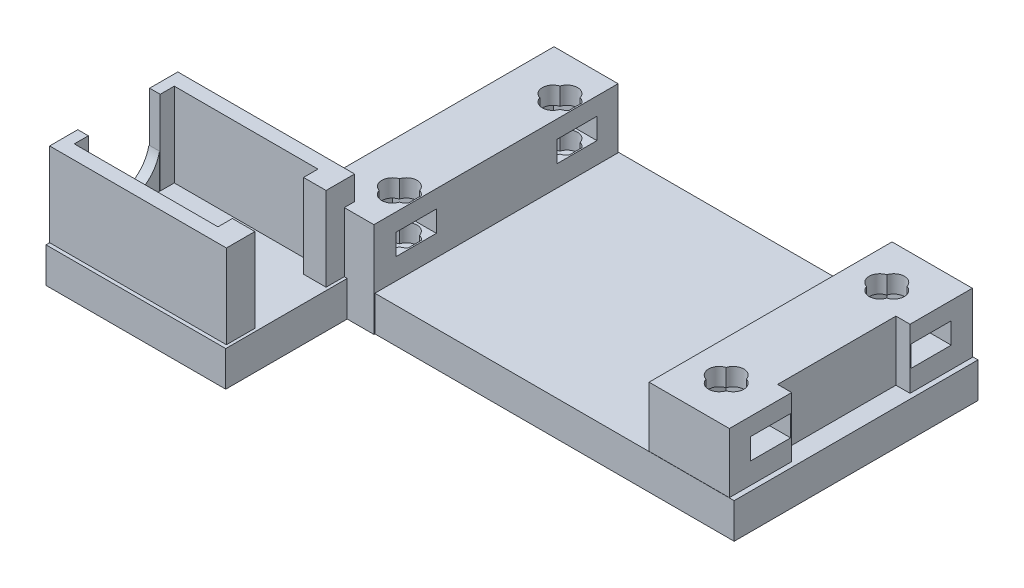
from build123d import *

# Parameters (mm, degrees)
BOSS_EXTRUDE3_START = -60
BOSS_EXTRUDE3_DEPTH = 5
SKETCH6_W           = 13.796901398
SKETCH6_H           = 14
SKETCH6_W_2         = 14
SKETCH6_H_2         = 16.306866668
SKETCH6_H_3         = 11.42033936
SKETCH6_W_3         = 14.889517864
SKETCH6_W_4         = 7.903270842
SKETCH6_H_4         = 11.041106068
SKETCH6_H_5         = 16.422438658
SKETCH6_H_6         = 19.310292274
SKETCH6_W_5         = 17.660118142
BOSS_EXTRUDE4_DEPTH = 37
BOSS_EXTRUDE5_DEPTH = 2
SKETCH8_R           = 1.55
CUT_EXTRUDE1_DEPTH  = 6
CUT_EXTRUDE2_START  = -2.5
CUT_EXTRUDE2_DEPTH  = 3
SKETCH10_W          = 29.9
SKETCH10_H          = 3
BOSS_EXTRUDE6_DEPTH = 3.1
SKETCH11_W          = 9.1
SKETCH11_H          = 34.669989019
BOSS_EXTRUDE7_DEPTH = 8.5
CUT_EXTRUDE3_DEPTH  = 8
CUT_EXTRUDE4_START  = -2.5
SKETCH14_W          = 7.6
SKETCH14_H          = 5.7
CUT_EXTRUDE4_DEPTH  = 3
BOSS_EXTRUDE8_DEPTH = 11.9
BOSS_EXTRUDE9_DEPTH = 1.499673419
CUT_EXTRUDE5_START  = 100
CUT_EXTRUDE5_DEPTH  = 200


with BuildPart() as part:
    # Sketch4 → Boss-Extrude3 (new body)
    with BuildSketch(Plane(origin=(0, 0, 0), x_dir=(1, 0, 0), z_dir=(0, 1, 0)).offset(BOSS_EXTRUDE3_START)):
        with BuildLine():
            Line((-79, -95), (79, -95))
            ThreePointArc((79, -95), (89.606601718, -90.606601718), (94, -80))
            Line((94, -80), (94, 80))
            ThreePointArc((94, 80), (89.606601718, 90.606601718), (79, 95))
            Line((79, 95), (-79, 95))
            ThreePointArc((-79, 95), (-89.606601718, 90.606601718), (-94, 80))
            Line((-94, 80), (-94, -80))
            ThreePointArc((-94, -80), (-89.606601718, -90.606601718), (-79, -95))
        make_face()
    extrude(amount=-BOSS_EXTRUDE3_DEPTH)

    # Sketch6 → Boss-Extrude4 (add)
    with BuildSketch(Plane(origin=(0, -60, 0), x_dir=(1, 0, 0), z_dir=(0, 1, 0))):
        with Locations((-70.8, 28.476784962)):
            Rectangle(SKETCH6_W, SKETCH6_H)
        with Locations((-39.020266387, 46.394045725)):
            Rectangle(SKETCH6_W_2, SKETCH6_H_2)
        with Locations((-7.988118752, 46.394045725)):
            Rectangle(SKETCH6_W_2, SKETCH6_H_2)
        with Locations((44.22727414, 46.394045725)):
            Rectangle(SKETCH6_W_2, SKETCH6_H_3)
        with Locations((72.6, 21.076479756)):
            Rectangle(SKETCH6_W_3, SKETCH6_H)
        with Locations((85.64, -55.06805056)):
            Rectangle(SKETCH6_W_4, SKETCH6_H)
        with Locations((57.347578499, -73.605954275)):
            Rectangle(SKETCH6_W_2, SKETCH6_H_4)
        with Locations((10.023553356, -73.605954275)):
            Rectangle(SKETCH6_W_2, SKETCH6_H_5)
        with Locations((-36.834989572, -73.605954275)):
            Rectangle(SKETCH6_W_2, SKETCH6_H_6)
        with Locations((-70.8, -52.206798888)):
            Rectangle(SKETCH6_W_5, SKETCH6_H)
    extrude(amount=BOSS_EXTRUDE4_DEPTH)

    # Sketch7 → Boss-Extrude5 (add)
    with BuildSketch(Plane(origin=(0, -23, 0), x_dir=(1, 0, 0), z_dir=(0, 1, 0))):
        Polygon((-70.8, -56.406798888), (-75, -56.406798888), (-75, -48.006798888), (-70.8, -48.006798888), (-70.8, -45.206798888), (-79.630059071, -45.206798888), (-79.630059071, -59.206798888), (-70.8, -59.206798888), align=None)
        Polygon((-41.034989572, -77.805954275), (-41.034989572, -73.605954275), (-43.834989572, -73.605954275), (-43.834989572, -83.261100412), (-29.834989572, -83.261100412), (-29.834989572, -73.605954275), (-32.634989572, -73.605954275), (-32.634989572, -77.805954275), align=None)
        Polygon((37.22727414, 46.394045725), (40.02727414, 46.394045725), (40.02727414, 50.594045725), (48.42727414, 50.594045725), (48.42727414, 46.394045725), (51.22727414, 46.394045725), (51.22727414, 52.104215405), (37.22727414, 52.104215405), align=None)
        Polygon((-14.988118752, 46.394045725), (-12.188118752, 46.394045725), (-12.188118752, 50.594045725), (-3.788118752, 50.594045725), (-3.788118752, 46.394045725), (-0.988118752, 46.394045725), (-0.988118752, 54.547479059), (-14.988118752, 54.547479059), align=None)
        Polygon((-46.020266387, 46.394045725), (-43.220266387, 46.394045725), (-43.220266387, 50.594045725), (-34.820266387, 50.594045725), (-34.820266387, 46.394045725), (-32.020266387, 46.394045725), (-32.020266387, 54.547479059), (-46.020266387, 54.547479059), align=None)
        Polygon((-70.8, 24.276784962), (-75, 24.276784962), (-75, 32.676784962), (-70.8, 32.676784962), (-70.8, 35.476784962), (-77.698450699, 35.476784962), (-77.698450699, 21.476784962), (-70.8, 21.476784962), align=None)
        Polygon((64.347578499, -73.605954275), (61.547578499, -73.605954275), (61.547578499, -77.805954275), (53.147578499, -77.805954275), (53.147578499, -73.605954275), (50.347578499, -73.605954275), (50.347578499, -79.126507309), (64.347578499, -79.126507309), align=None)
        Polygon((72.6, 25.276479756), (76.8, 25.276479756), (76.8, 16.876479756), (72.6, 16.876479756), (72.6, 14.076479756), (80.044758932, 14.076479756), (80.044758932, 28.076479756), (72.6, 28.076479756), align=None)
        Polygon((17.023553356, -73.605954275), (14.223553356, -73.605954275), (14.223553356, -77.805954275), (5.823553356, -77.805954275), (5.823553356, -73.605954275), (3.023553356, -73.605954275), (3.023553356, -81.817173604), (17.023553356, -81.817173604), align=None)
    extrude(amount=BOSS_EXTRUDE5_DEPTH)

    # Sketch8 → Cut-Extrude1 (cut)
    with BuildSketch(Plane(origin=(0, -23, 0), x_dir=(1, 0, 0), z_dir=(0, 1, 0))):
        with Locations(Location((-36.834989572, -73.605954275, 0), (0, 0, 270))):
            Circle(SKETCH8_R)
        with Locations(Location((-39.020266387, 46.394045725, 0), (0, 0, 270))):
            Circle(SKETCH8_R)
        with Locations(Location((-7.988118752, 46.394045725, 0), (0, 0, 270))):
            Circle(SKETCH8_R)
        with Locations(Location((44.22727414, 46.394045725, 0), (0, 0, 270))):
            Circle(SKETCH8_R)
        with Locations(Location((72.6, 21.076479756, 0), (0, 0, 270))):
            Circle(SKETCH8_R)
        with Locations(Location((85.64, -55.06805056, 0), (0, 0, 270))):
            Circle(SKETCH8_R)
        with Locations(Location((57.347578499, -73.605954275, 0), (0, 0, 270))):
            Circle(SKETCH8_R)
        with Locations(Location((10.023553356, -73.605954275, 0), (0, 0, 270))):
            Circle(SKETCH8_R)
        with Locations(Location((-70.8, -52.206798888, 0), (0, 0, 270))):
            Circle(SKETCH8_R)
        with Locations(Location((-70.8, 28.476784962, 0), (0, 0, 270))):
            Circle(SKETCH8_R)
    extrude(amount=-CUT_EXTRUDE1_DEPTH, mode=Mode.SUBTRACT)

    # Sketch9 → Cut-Extrude2 (cut)
    with BuildSketch(Plane(origin=(0, -23, 0), x_dir=(1, 0, 0), z_dir=(0, 1, 0)).offset(CUT_EXTRUDE2_START)):
        Polygon((-73.65, 25.626784962), (-73.65, 31.326784962), (-67.95, 31.326784962), (-67.95, 25.626784962), (-67.95, 21.476784962), (-73.65, 21.476784962), align=None)
        Polygon((-41.870266387, 43.544045725), (-41.870266387, 49.244045725), (-41.870266387, 54.547479059), (-36.170266387, 54.547479059), (-36.170266387, 49.244045725), (-36.170266387, 43.544045725), align=None)
        Polygon((-10.838118752, 43.544045725), (-10.838118752, 49.244045725), (-10.838118752, 54.547479059), (-5.138118752, 54.547479059), (-5.138118752, 49.244045725), (-5.138118752, 43.544045725), align=None)
        Polygon((41.37727414, 43.544045725), (41.37727414, 49.244045725), (41.37727414, 52.104215405), (47.07727414, 52.104215405), (47.07727414, 49.244045725), (47.07727414, 43.544045725), align=None)
        Polygon((69.75, 18.226479756), (69.75, 23.926479756), (69.75, 28.076479756), (75.45, 28.076479756), (75.45, 23.926479756), (75.45, 18.226479756), align=None)
        Polygon((82.79, -57.91805056), (82.79, -52.21805056), (88.49, -52.21805056), (88.49, -57.91805056), (88.49, -62.06805056), (82.79, -62.06805056), align=None)
        Polygon((54.497578499, -76.455954275), (54.497578499, -70.755954275), (60.197578499, -70.755954275), (60.197578499, -76.455954275), (60.197578499, -79.126507309), (54.497578499, -79.126507309), align=None)
        Polygon((7.173553356, -76.455954275), (7.173553356, -70.755954275), (12.873553356, -70.755954275), (17.023553356, -70.755954275), (17.023553356, -76.455954275), (12.873553356, -76.455954275), align=None)
        Polygon((-39.684989572, -70.755954275), (-33.984989572, -70.755954275), (-33.984989572, -76.455954275), (-39.684989572, -76.455954275), (-43.834989572, -76.455954275), (-43.834989572, -70.755954275), align=None)
        Polygon((-73.65, -55.056798888), (-73.65, -49.356798888), (-73.65, -45.206798888), (-67.95, -45.206798888), (-67.95, -49.356798888), (-67.95, -55.056798888), align=None)
    extrude(amount=-CUT_EXTRUDE2_DEPTH, mode=Mode.SUBTRACT)

    # Sketch10 → Boss-Extrude6 (add)
    with BuildSketch(Plane(origin=(0, -60, 0), x_dir=(1, 0, 0), z_dir=(0, 1, 0))):
        Polygon((-55.431481691, 41.136880013), (-55.431481691, 38.136880013), (-25.531481691, 38.136880013), (-25.531481691, 41.136880013), (-32.020266387, 41.136880013), (-32.020266387, 38.240612391), (-46.020266387, 38.240612391), (-46.020266387, 41.136880013), align=None)
        with Locations((-40.481481691, 18.236880013)):
            Rectangle(SKETCH10_W, SKETCH10_H)
    extrude(amount=BOSS_EXTRUDE6_DEPTH)

    # Sketch11 → Boss-Extrude7 (add)
    with BuildSketch(Plane(origin=(0, -60, 0), x_dir=(1, 0, 0), z_dir=(0, 1, 0))):
        Polygon((-25.797386747, 55.296562101), (-14.397386747, 55.296562101), (-14.397386747, 64.146562101), (-16.397386747, 64.146562101), (-16.397386747, 80.946562101), (-14.397386747, 80.946562101), (-14.397386747, 89.796562101), (-25.797386747, 89.796562101), align=None)
        with Locations((-69.247386747, 72.461567591)):
            Rectangle(SKETCH11_W, SKETCH11_H)
    extrude(amount=BOSS_EXTRUDE7_DEPTH)

    # Sketch12 → Cut-Extrude3 (cut)
    with BuildSketch(Plane(origin=(0, -51.5, 0), x_dir=(1, 0, 0), z_dir=(0, 1, 0))):
        with BuildLine():
            ThreePointArc((-65.661972401, 82.511147754), (-65.236972805, 82.717868547), (-64.897386747, 83.046562101))
            Line((-64.897386747, 83.046562101), (-64.897386747, 84.846562101))
            ThreePointArc((-64.897386747, 84.846562101), (-65.236972805, 85.175255654), (-65.661972401, 85.381976447))
            ThreePointArc((-65.661972401, 85.381976447), (-67.097386747, 86.446562101), (-68.532801094, 85.381976447))
            ThreePointArc((-68.532801094, 85.381976447), (-69.597386747, 83.946562101), (-68.532801094, 82.511147754))
            ThreePointArc((-68.532801094, 82.511147754), (-67.097386747, 81.446562101), (-65.661972401, 82.511147754))
        make_face()
        with BuildLine():
            ThreePointArc((-19.261972401, 82.511147754), (-18.197386747, 83.946562101), (-19.261972401, 85.381976447))
            ThreePointArc((-19.261972401, 85.381976447), (-20.697386747, 86.446562101), (-22.132801094, 85.381976447))
            ThreePointArc((-22.132801094, 85.381976447), (-23.197386747, 83.946562101), (-22.132801094, 82.511147754))
            ThreePointArc((-22.132801094, 82.511147754), (-20.697386747, 81.446562101), (-19.261972401, 82.511147754))
        make_face()
        with BuildLine():
            ThreePointArc((-19.261972401, 59.711147754), (-18.197386747, 61.146562101), (-19.261972401, 62.581976447))
            ThreePointArc((-19.261972401, 62.581976447), (-20.697386747, 63.646562101), (-22.132801094, 62.581976447))
            ThreePointArc((-22.132801094, 62.581976447), (-23.197386747, 61.146562101), (-22.132801094, 59.711147754))
            ThreePointArc((-22.132801094, 59.711147754), (-20.697386747, 58.646562101), (-19.261972401, 59.711147754))
        make_face()
        with BuildLine():
            ThreePointArc((-65.661972401, 59.711147754), (-65.236972805, 59.917868547), (-64.897386747, 60.246562101))
            Line((-64.897386747, 60.246562101), (-64.897386747, 62.046562101))
            ThreePointArc((-64.897386747, 62.046562101), (-65.236972805, 62.375255654), (-65.661972401, 62.581976447))
            ThreePointArc((-65.661972401, 62.581976447), (-67.097386747, 63.646562101), (-68.532801094, 62.581976447))
            ThreePointArc((-68.532801094, 62.581976447), (-69.597386747, 61.146562101), (-68.532801094, 59.711147754))
            ThreePointArc((-68.532801094, 59.711147754), (-67.097386747, 58.646562101), (-65.661972401, 59.711147754))
        make_face()
    extrude(amount=-CUT_EXTRUDE3_DEPTH, mode=Mode.SUBTRACT)

    # Sketch14 → Cut-Extrude4 (cut)
    with BuildSketch(Plane(origin=(0, -51.5, 0), x_dir=(1, 0, 0), z_dir=(0, 1, 0)).offset(CUT_EXTRUDE4_START)):
        with Locations((-67.097386747, 83.946562101)):
            Rectangle(SKETCH14_W, SKETCH14_H)
        with Locations((-67.097386747, 61.146562101)):
            Rectangle(SKETCH14_W, SKETCH14_H)
        Polygon((-23.547386747, 81.096562101), (-17.847386747, 81.096562101), (-14.397386747, 81.096562101), (-14.397386747, 86.796562101), (-17.847386747, 86.796562101), (-23.547386747, 86.796562101), align=None)
        Polygon((-23.547386747, 58.296562101), (-17.847386747, 58.296562101), (-14.397386747, 58.296562101), (-14.397386747, 63.996562101), (-17.847386747, 63.996562101), (-23.547386747, 63.996562101), align=None)
    extrude(amount=-CUT_EXTRUDE4_DEPTH, mode=Mode.SUBTRACT)

    # Sketch15 → Boss-Extrude8 (add)
    with BuildSketch(Plane(origin=(0, -60, 0), x_dir=(1, 0, 0), z_dir=(0, 1, 0))):
        Polygon((-94, 52.589239073), (-92.500326581, 52.589239073), (-92.500326581, 54.589239073), (-72.100326581, 54.589239073), (-72.100326581, 52.539239073), (-68.900326581, 52.539239073), (-68.900326581, 56.589239073), (-94, 56.589239073), align=None)
        Polygon((-92.500326581, 40.389239073), (-92.500326581, 42.389239073), (-94, 42.389239073), (-94, 38.389239073), (-68.900326581, 38.389239073), (-68.900326581, 42.439239073), (-72.100326581, 42.439239073), (-72.100326581, 40.389239073), align=None)
    extrude(amount=BOSS_EXTRUDE8_DEPTH)

    # Sketch16 → Boss-Extrude9 (add)
    with BuildSketch(Plane(origin=(-92.500326581, 0, 0), x_dir=(0, 0, -1), z_dir=(1, 0, 0))):
        with BuildLine():
            Line((42.489239073, -60), (52.489239073, -60))
            Line((52.489239073, -60), (52.489239073, -55.054987562))
            ThreePointArc((52.489239073, -55.054987562), (47.489239073, -59.15), (42.489239073, -55.054987562))
            Line((42.489239073, -55.054987562), (42.489239073, -60))
        make_face()
    extrude(amount=-BOSS_EXTRUDE9_DEPTH)

    # Sketch17 → Cut-Extrude5 (cut)
    with BuildSketch(Plane(origin=(0, -60, 0), x_dir=(1, 0, 0), z_dir=(0, 1, 0)).offset(CUT_EXTRUDE5_START)):
        with BuildLine():
            Line((-68.483383313, 37.875054154), (-94, 37.875054154))
            Line((-94, 37.875054154), (-94, -80))
            ThreePointArc((-94, -80), (-89.606601718, -90.606601718), (-79, -95))
            Line((-79, -95), (79, -95))
            ThreePointArc((79, -95), (89.606601718, -90.606601718), (94, -80))
            Line((94, -80), (94, 80))
            ThreePointArc((94, 80), (89.606601718, 90.606601718), (79, 95))
            Line((79, 95), (-79, 95))
            ThreePointArc((-79, 95), (-89.606601718, 90.606601718), (-94, 80))
            Line((-94, 80), (-94, 57.556628821))
            Line((-94, 57.556628821), (-74.033129658, 57.556628821))
            Line((-74.033129658, 57.556628821), (-74.033129658, 89.888723267))
            Line((-74.033129658, 89.888723267), (-13.688048595, 89.888723267))
            Line((-13.688048595, 89.888723267), (-13.688048595, 55.268073627))
            Line((-13.688048595, 55.268073627), (-64.697386747, 55.268073627))
            Line((-64.697386747, 55.268073627), (-64.697386747, 55.126573082))
            Line((-64.697386747, 55.126573082), (-68.483383313, 55.126573082))
            Line((-68.483383313, 55.126573082), (-68.483383313, 37.875054154))
        make_face()
    extrude(amount=-CUT_EXTRUDE5_DEPTH, mode=Mode.SUBTRACT)


solid = part.part
